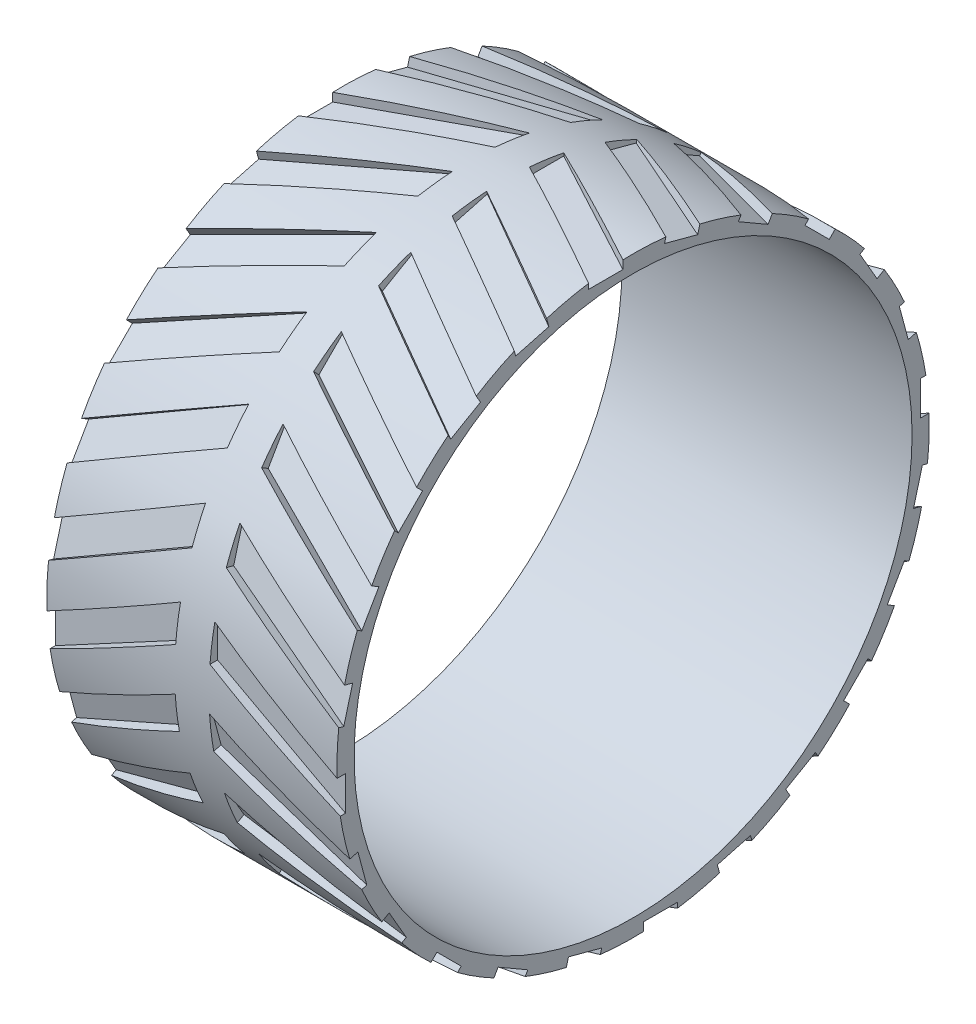
from build123d import *
from build123d.topology import SkipClean

# Parameters (mm, degrees)
SKETCH1_R                = 34.5
SKETCH1_R_2              = 32.5
BOSS_EXTRUDE1_DEPTH      = 33.8
CUT_EXTRUDE1_DEPTH       = 30.8
CIRPATTERN2_COUNT        = 24
BOSS_EXTRUDE2_DEPTH      = 2
BOSS_EXTRUDE2_DEPTH_BACK = 2
SKETCH4_R                = 34.5
SKETCH4_R_2              = 32.5


with BuildPart() as part:
    # Sketch1 → Boss-Extrude1 (new body)
    with BuildSketch(Plane(origin=(0, 0, 0), x_dir=(0, 0, -1), z_dir=(1, 0, 0))):
        Circle(SKETCH1_R)
        Circle(SKETCH1_R_2, mode=Mode.SUBTRACT)
    extrude(amount=BOSS_EXTRUDE1_DEPTH)

    # Sketch2 → Cut-Extrude1 (cut)
    with BuildSketch(Plane(origin=(0, 33.5, 0), x_dir=(1, 0, 0), z_dir=(0, 1, 0))):
        Polygon((16.9, 7.900383354), (0, -1.184613224), (0, -5.184613224), (16.9, 3.900383354), (33.8, -5.184613224), (33.8, -1.184613224), align=None)
    cut_extrude1 = extrude(amount=CUT_EXTRUDE1_DEPTH, mode=Mode.SUBTRACT)

    # CirPattern2: Cut-Extrude1 ×24 about axis
    cirpattern2_axis = Axis((33.8, 0, 0), (-1, 0, 0))
    for i in range(1, CIRPATTERN2_COUNT):
        add(cut_extrude1.rotate(cirpattern2_axis, i * 360 / CIRPATTERN2_COUNT), mode=Mode.SUBTRACT)

    # Sketch4 → Boss-Extrude2 (add, two sides: drawn at the far end of the back side and taken through both)
    with SkipClean():  # the faces are left unmerged after this step: merging them gives an invalid solid
        with BuildSketch(Plane.ZY.offset(-16.9).offset(-BOSS_EXTRUDE2_DEPTH_BACK)):
            Circle(SKETCH4_R)
            Circle(SKETCH4_R_2, mode=Mode.SUBTRACT)
        extrude(amount=BOSS_EXTRUDE2_DEPTH + BOSS_EXTRUDE2_DEPTH_BACK)


solid = part.part
